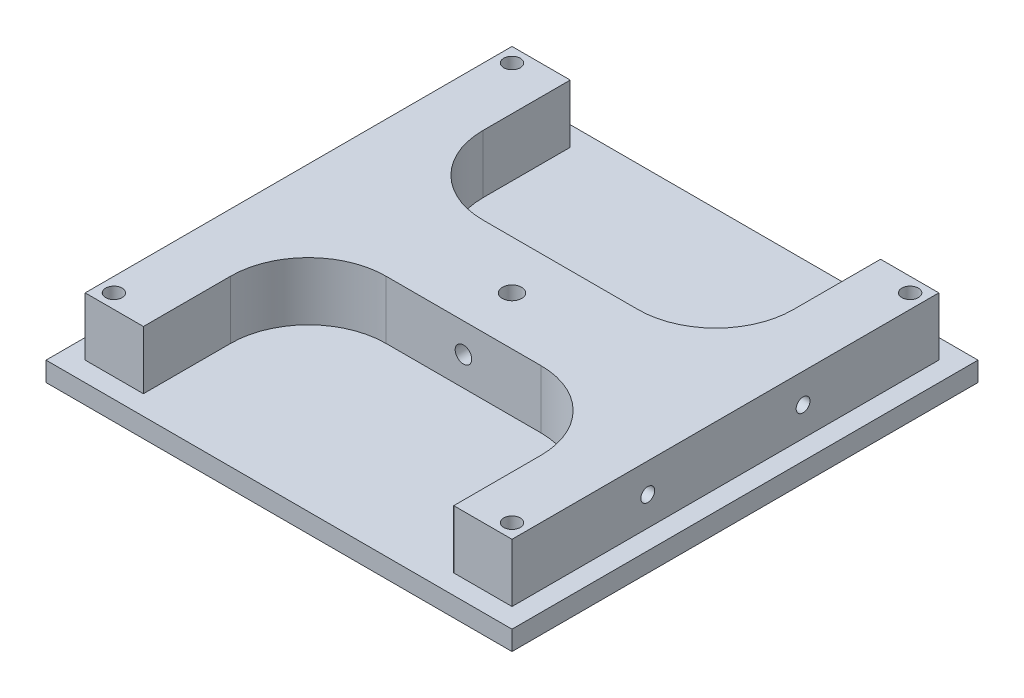
from build123d import *

# Parameters (mm, degrees)
SKETCH1_W             = 76.2
SKETCH1_H             = 76.2
BOSS_EXTRUDE1_DEPTH   = 3.175
SKETCH2_W             = 69.79412
SKETCH2_H             = 69.79412
BOSS_EXTRUDE2_DEPTH   = 9.525
F_6_32_TAPPED_HOLE1_D = 2.7051
CIRPATTERN1_COUNT     = 4
SKETCH14_R            = 3.175
CUT_EXTRUDE1_DEPTH    = 56.358016583
SKETCH15_W            = 50.74412
SKETCH15_H            = 26.95956
CUT_EXTRUDE2_DEPTH    = 9.525
FILLET1_R             = 12.7
FILLET1_OF_MIRROR3_R  = 12.7
BOSS_EXTRUDE3_START   = -2.54
SKETCH20_R            = 3.175
SKETCH20_R_2          = 1.5875
BOSS_EXTRUDE3_DEPTH   = 2.54


with BuildPart() as part:
    # Sketch1 → Boss-Extrude1 (new body)
    with BuildSketch(Plane(origin=(0, 0, 0), x_dir=(1, 0, 0), z_dir=(0, 1, 0))):
        Rectangle(SKETCH1_W, SKETCH1_H)
    extrude(amount=BOSS_EXTRUDE1_DEPTH)

    # Sketch2 → Boss-Extrude2 (add)
    with BuildSketch(Plane(origin=(0, 3.175, 0), x_dir=(1, 0, 0), z_dir=(0, 1, 0))):
        Rectangle(SKETCH2_W, SKETCH2_H)
    extrude(amount=BOSS_EXTRUDE2_DEPTH)

    # Sketch9 → #4-40 Tapped Hole1 (revolve, cut)
    with BuildSketch(Plane(origin=(34.89706, 7.9375, 12.7), x_dir=(0, 0, -1), z_dir=(0, 1, 0))):
        Polygon((0, 0), (0, 7.283152758), (1.1303, 6.604), (1.1303, 0), align=None)
    f_4_40_tapped_hole1 = revolve(axis=Axis((41.24706, 7.9375, 12.7), (-1, 0, 0)), mode=Mode.SUBTRACT)

    # Mirror1: #4-40 Tapped Hole1 across plane
    add(f_4_40_tapped_hole1.mirror(Plane.XY), mode=Mode.SUBTRACT)

    # Mirror2 copy 1 sketch → Mirror2 copy 1 (revolve, cut)
    with BuildSketch(Plane(origin=(-34.89706, 7.9375, -12.7), x_dir=(0, 0, 1), z_dir=(0, 1, 0))):
        Polygon((0, 0), (0, 7.283152758), (1.1303, 6.604), (1.1303, 0), align=None)
    revolve(axis=Axis((-41.24706, 7.9375, -12.7), (1, 0, 0)), mode=Mode.SUBTRACT)

    # Mirror2 copy 2 sketch → Mirror2 copy 2 (revolve, cut)
    with BuildSketch(Plane(origin=(-34.89706, 7.9375, 12.7), x_dir=(0, 0, -1), z_dir=(0, 1, 0))):
        Polygon((0, 0), (0, -7.283152758), (1.1303, -6.604), (1.1303, 0), align=None)
    revolve(axis=Axis((-41.24706, 7.9375, 12.7), (-1, 0, 0)), mode=Mode.SUBTRACT)

    # #6-32 Tapped Hole1 (through all)
    with Locations(Plane(origin=(0, 0, 0), x_dir=(-1, 0, 0), z_dir=(0, -1, 0))):
        with Locations((-32.5501, 32.5501)):
            f_6_32_tapped_hole1 = Hole(F_6_32_TAPPED_HOLE1_D / 2)

    # CirPattern1: #6-32 Tapped Hole1 ×4 about axis
    cirpattern1_axis = Axis((0, -0.635, 0), (0, 1, 0))
    for i in range(1, CIRPATTERN1_COUNT):
        add(f_6_32_tapped_hole1.rotate(cirpattern1_axis, i * 360 / CIRPATTERN1_COUNT), mode=Mode.SUBTRACT)

    # Sketch14 → Cut-Extrude1 (cut, through all)
    with BuildSketch(Plane.XZ):
        Circle(SKETCH14_R)
    extrude(amount=-CUT_EXTRUDE1_DEPTH, mode=Mode.SUBTRACT)

    # Sketch15 → Cut-Extrude2 (cut)
    with BuildSketch(Plane(origin=(0, 12.7, 0), x_dir=(1, 0, 0), z_dir=(0, 1, 0))):
        with Locations((0, -21.41728)):
            Rectangle(SKETCH15_W, SKETCH15_H)
    cut_extrude2 = extrude(amount=-CUT_EXTRUDE2_DEPTH, mode=Mode.SUBTRACT)

    # Fillet1
    fillet1_edges = [part.edges().sort_by_distance(p)[0] for p in [
        (25.37206, 7.9375, 7.9375),
        (-25.37206, 7.9375, 7.9375),
    ]]
    fillet(fillet1_edges, radius=FILLET1_R)

    # Sketch17 → #6-32 Tapped Hole2 (revolve, cut)
    with BuildSketch(Plane(origin=(0, 7.9375, 7.9375), x_dir=(0, -1, 0), z_dir=(1, 0, 0))):
        Polygon((0, 0), (0, 10.46469403), (1.35255, 9.652), (1.35255, 0), align=None)
    f_6_32_tapped_hole2 = revolve(axis=Axis((0, 7.9375, 14.2875), (0, 0, -1)), mode=Mode.SUBTRACT)

    # Mirror3: Cut-Extrude2, #6-32 Tapped Hole2 across plane
    add(cut_extrude2.mirror(Plane.XY), mode=Mode.SUBTRACT)
    add(f_6_32_tapped_hole2.mirror(Plane.XY), mode=Mode.SUBTRACT)

    # Fillet1 of Mirror3
    fillet1_of_mirror3_edges = [part.edges().sort_by_distance(p)[0] for p in [
        (25.37206, 7.9375, -7.9375),
        (-25.37206, 7.9375, -7.9375),
    ]]
    fillet(fillet1_of_mirror3_edges, radius=FILLET1_OF_MIRROR3_R)

    # Sketch20 → Boss-Extrude3 (add)
    with BuildSketch(Plane(origin=(0, 12.7, 0), x_dir=(1, 0, 0), z_dir=(0, 1, 0)).offset(BOSS_EXTRUDE3_START)):
        Circle(SKETCH20_R)
        Circle(SKETCH20_R_2, mode=Mode.SUBTRACT)
    extrude(amount=BOSS_EXTRUDE3_DEPTH)


solid = part.part
